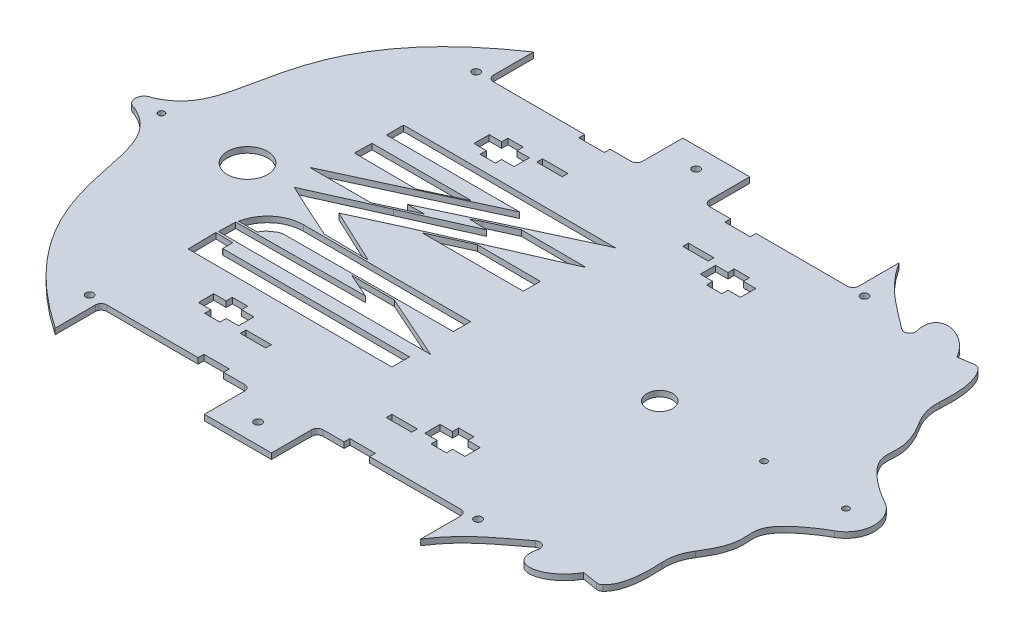
from build123d import *

# Parameters (mm, degrees)
BOSS_EXTRUDE1_OUTLINE_R   = 2
BOSS_EXTRUDE1_OUTLINE_W   = 13.3
BOSS_EXTRUDE1_OUTLINE_H   = 3
BOSS_EXTRUDE1_OUTLINE_R_2 = 1.65
BOSS_EXTRUDE1_OUTLINE_R_3 = 10.5
BOSS_EXTRUDE1_OUTLINE_R_4 = 6.79023159
BOSS_EXTRUDE1_DEPTH       = 3
CUT_EXTRUDE4_DEPTH        = 10


# Read off the part's stored shape, not the designer's step: Boss-Extrude1
with BuildPart() as part:
    # Boss-Extrude1 outline → Boss-Extrude1 (new body)
    with BuildSketch(Plane(origin=(0, 0, 0), x_dir=(1, 0, 0), z_dir=(0, 1, 0))):
        with BuildLine():
            Line((-17.5, -125), (17.5, -125))
            Line((17.5, -125), (17.5, -104))
            ThreePointArc((17.5, -104), (18.378679656, -101.878679656), (20.5, -101))
            Line((20.5, -101), (31.5, -101))
            Line((31.5, -101), (31.5, -98))
            Line((31.5, -98), (44.8, -98))
            Line((44.8, -98), (44.8, -101))
            Line((44.8, -101), (92.5, -101))
            ThreePointArc((92.5, -101), (94.621320344, -101.878679656), (95.5, -104))
            Line((95.5, -104), (95.5, -125))
            add(Edge.make_bspline(
                [(95.5, -125), (100.50637567, -117.140298034), (105.886665873, -111.407933588), (111.304893081, -106.912987865), (116.554589842, -103.049372367), (121.529527182, -99.421345381), (126.195868804, -95.78655124)],
                knots=[0, 0, 0, 0, 0, 0, 0, 1, 1, 1, 1, 1, 1, 1], degree=6))
            ThreePointArc((126.195868804, -95.78655124), (129.670016542, -95.635122312), (130.953228512, -98.867149581))
            add(Edge.make_bspline(
                [(153.274628862, -97.551277914), (145.048399434, -111.792305855), (127.194583112, -114.208852006), (130.953228512, -98.867149581)],
                knots=[0, 0, 0, 0, 1, 1, 1, 1], degree=3))
            Line((153.274628862, -97.551277914), (161.289057872, -98.799749198))
            ThreePointArc((161.289057872, -98.799749198), (162.627947201, -98.704411327), (163.791244557, -98.034744837))
            add(Edge.make_bspline(
                [(169.122281436, -72.559473626), (170.349939803, -91.949698752), (163.791244557, -98.034744837)],
                knots=[0, 0, 0, 1, 1, 1], degree=2))
            ThreePointArc((169.122281436, -72.559473626), (169.821390303, -65.299453256), (172.758472208, -58.623361671))
            add(Edge.make_bspline(
                [(172.758472208, -58.623361671), (188.119789729, -34.850874063), (172.499672596, -36.387007457), (178.196892258, -29.278969494), (184.712224404, -22.879053943), (192.076321024, -17.426235598), (200.000000002, -13.073844001)],
                knots=[0, 0, 0, 0, 0, 0, 0, 1, 1, 1, 1, 1, 1, 1], degree=6))
            ThreePointArc((200.000000002, -13.073844001), (207.735004137, 0), (200.000000002, 13.073844001))
            add(Edge.make_bspline(
                [(172.758472208, 58.623361671), (188.119789729, 34.850874063), (172.499672596, 36.387007457), (178.196892258, 29.278969494), (184.712224404, 22.879053943), (192.076321024, 17.426235598), (200.000000002, 13.073844001)],
                knots=[0, 0, 0, 0, 0, 0, 0, 1, 1, 1, 1, 1, 1, 1], degree=6))
            ThreePointArc((172.758472208, 58.623361671), (169.821390303, 65.299453256), (169.122281436, 72.559473626))
            add(Edge.make_bspline(
                [(169.122281436, 72.559473626), (170.349939803, 91.949698752), (163.791244557, 98.034744837)],
                knots=[0, 0, 0, 1, 1, 1], degree=2))
            ThreePointArc((163.791244557, 98.034744837), (162.627947201, 98.704411327), (161.289057872, 98.799749198))
            Line((161.289057872, 98.799749198), (153.274628862, 97.551277914))
            add(Edge.make_bspline(
                [(153.274628862, 97.551277914), (145.048399434, 111.792305855), (127.194583112, 114.208852006), (130.953228512, 98.867149581)],
                knots=[0, 0, 0, 0, 1, 1, 1, 1], degree=3))
            ThreePointArc((130.953228512, 98.867149581), (129.670016542, 95.635122312), (126.195868804, 95.78655124))
            add(Edge.make_bspline(
                [(95.5, 125), (100.50637567, 117.140298034), (105.886665873, 111.407933588), (111.304893081, 106.912987865), (116.554589842, 103.049372367), (121.529527182, 99.421345381), (126.195868804, 95.78655124)],
                knots=[0, 0, 0, 0, 0, 0, 0, 1, 1, 1, 1, 1, 1, 1], degree=6))
            Line((95.5, 125), (95.5, 104))
            ThreePointArc((95.5, 104), (94.621320344, 101.878679656), (92.5, 101))
            Line((92.5, 101), (44.8, 101))
            Line((44.8, 101), (44.8, 98))
            Line((44.8, 98), (31.5, 98))
            Line((31.5, 98), (31.5, 101))
            Line((31.5, 101), (20.5, 101))
            ThreePointArc((20.5, 101), (18.378679656, 101.878679656), (17.5, 104))
            Line((17.5, 104), (17.5, 125))
            Line((17.5, 125), (-17.5, 125))
            Line((-17.5, 125), (-17.5, 104))
            ThreePointArc((-17.5, 104), (-18.378679656, 101.878679656), (-20.5, 101))
            Line((-20.5, 101), (-31.5, 101))
            Line((-31.5, 101), (-31.5, 98))
            Line((-31.5, 98), (-44.8, 98))
            Line((-44.8, 98), (-44.8, 101))
            Line((-44.8, 101), (-92.5, 101))
            ThreePointArc((-92.5, 101), (-94.621320344, 101.878679656), (-95.5, 104))
            Line((-95.5, 104), (-95.5, 125))
            add(Edge.make_bspline(
                [(-95.5, 125), (-175.934318521, 70.42019649), (-139.024894587, 19.752046012), (-174.613334244, 4.587313777)],
                knots=[0, 0, 0, 0, 1, 1, 1, 1], degree=3))
            ThreePointArc((-174.613334244, 4.587313777), (-178.628134245, 0), (-174.613334244, -4.587313777))
            add(Edge.make_bspline(
                [(-95.5, -125), (-175.934318521, -70.42019649), (-139.024894587, -19.752046012), (-174.613334244, -4.587313777)],
                knots=[0, 0, 0, 0, 1, 1, 1, 1], degree=3))
            Line((-95.5, -125), (-95.5, -104))
            ThreePointArc((-95.5, -104), (-94.621320344, -101.878679656), (-92.5, -101))
            Line((-92.5, -101), (-44.8, -101))
            Line((-44.8, -101), (-44.8, -98))
            Line((-44.8, -98), (-31.5, -98))
            Line((-31.5, -98), (-31.5, -101))
            Line((-31.5, -101), (-20.5, -101))
            ThreePointArc((-20.5, -101), (-18.378679656, -101.878679656), (-17.5, -104))
            Line((-17.5, -104), (-17.5, -125))
        make_face()
        with Locations((-101.5, -101)):
            Circle(BOSS_EXTRUDE1_OUTLINE_R, mode=Mode.SUBTRACT)
        with Locations((0, -114.5)):
            Circle(BOSS_EXTRUDE1_OUTLINE_R, mode=Mode.SUBTRACT)
        Polygon((-63.15, -79.25), (-63.15, -76), (-69.65, -76), (-69.65, -68), (-63.15, -68), (-63.15, -64.75), (-55.15, -64.75), (-55.15, -68), (-48.65, -68), (-48.65, -76), (-55.15, -76), (-55.15, -79.25), align=None, mode=Mode.SUBTRACT)
        with Locations((-38.15, -77.5)):
            Rectangle(BOSS_EXTRUDE1_OUTLINE_W, BOSS_EXTRUDE1_OUTLINE_H, mode=Mode.SUBTRACT)
        with Locations((101.5, -101)):
            Circle(BOSS_EXTRUDE1_OUTLINE_R, mode=Mode.SUBTRACT)
        with Locations((38.15, -77.5)):
            Rectangle(BOSS_EXTRUDE1_OUTLINE_W, BOSS_EXTRUDE1_OUTLINE_H, mode=Mode.SUBTRACT)
        Polygon((55.15, -68), (55.15, -64.75), (63.15, -64.75), (63.15, -68), (69.65, -68), (69.65, -76), (63.15, -76), (63.15, -79.25), (55.15, -79.25), (55.15, -76), (48.65, -76), (48.65, -68), align=None, mode=Mode.SUBTRACT)
        with Locations((-165, 0)):
            Circle(BOSS_EXTRUDE1_OUTLINE_R_2, mode=Mode.SUBTRACT)
        with Locations((-120, 0)):
            Circle(BOSS_EXTRUDE1_OUTLINE_R_3, mode=Mode.SUBTRACT)
        with Locations((-101.5, 101)):
            Circle(BOSS_EXTRUDE1_OUTLINE_R, mode=Mode.SUBTRACT)
        Polygon((-63.15, 79.25), (-55.15, 79.25), (-55.15, 76), (-48.65, 76), (-48.65, 68), (-55.15, 68), (-55.15, 64.75), (-63.15, 64.75), (-63.15, 68), (-69.65, 68), (-69.65, 76), (-63.15, 76), align=None, mode=Mode.SUBTRACT)
        with Locations((-38.15, 77.5)):
            Rectangle(BOSS_EXTRUDE1_OUTLINE_W, BOSS_EXTRUDE1_OUTLINE_H, mode=Mode.SUBTRACT)
        with Locations((0, 114.5)):
            Circle(BOSS_EXTRUDE1_OUTLINE_R, mode=Mode.SUBTRACT)
        with Locations((95.5, 0)):
            Circle(BOSS_EXTRUDE1_OUTLINE_R_4, mode=Mode.SUBTRACT)
        with Locations((150, 0)):
            Circle(BOSS_EXTRUDE1_OUTLINE_R_2, mode=Mode.SUBTRACT)
        with Locations((192.818678179, 0)):
            Circle(BOSS_EXTRUDE1_OUTLINE_R_2, mode=Mode.SUBTRACT)
        with Locations((38.15, 77.5)):
            Rectangle(BOSS_EXTRUDE1_OUTLINE_W, BOSS_EXTRUDE1_OUTLINE_H, mode=Mode.SUBTRACT)
        Polygon((63.15, 79.25), (63.15, 76), (69.65, 76), (69.65, 68), (63.15, 68), (63.15, 64.75), (55.15, 64.75), (55.15, 68), (48.65, 68), (48.65, 76), (55.15, 76), (55.15, 79.25), align=None, mode=Mode.SUBTRACT)
        with Locations((101.5, 101)):
            Circle(BOSS_EXTRUDE1_OUTLINE_R, mode=Mode.SUBTRACT)
    extrude(amount=BOSS_EXTRUDE1_DEPTH)

    # Sketch5 → Cut-Extrude4 (cut)
    with BuildSketch(Plane(origin=(0, 3, 0), x_dir=(1, 0, 0), z_dir=(0, 1, 0))):
        Polygon((-16.280980711, 43.449751583), (14.519017205, 57.749751587), (-96.360980711, 57.969751583), (-96.360980711, 49.788115102), (-96.368321319, 48.973981164), (-26.707422059, 48.973981164), (-101.834351235, 14.242892369), (-69.727593728, 14.242892369), (-50.673024428, 23.089657287), (-59.428531363, 23.089657287), align=None)
        with BuildLine():
            Line((10.119019289, -22.550248417), (10.119019289, -13.530248417))
            Line((10.119019289, -13.530248417), (-77.459409297, -13.309647841))
            ThreePointArc((-77.459409297, -13.309647841), (-89.491285343, -17.652122629), (-95.920980711, -28.710248417))
            Line((-95.920980711, -28.710248417), (-86.240980711, -28.710248417))
            Line((-86.240980711, -28.710248417), (-84.480980711, -26.070248417))
            Line((-84.480980711, -26.070248417), (-81.400980711, -23.870248417))
            ThreePointArc((-81.400980711, -23.870248417), (-79.728995968, -23.038599596), (-77.880980711, -22.770248417))
            Line((-77.880980711, -22.770248417), (10.119019289, -22.550248417))
        make_face()
        Polygon((-87.780980711, -39.930248417), (-96.800980711, -39.710248417), (-96.580980711, -54.450248417), (7.479019289, -54.670248417), (10.119019289, -54.670248417), (10.119019289, -45.430248417), (-87.340980711, -45.210248417), (-87.780980711, -45.210248417), align=None)
        with BuildLine():
            Line((-32.340980711, 34.869751583), (-36.520980711, 32.669751583))
            Line((-36.520980711, 32.669751583), (-27.280980711, 32.229751583))
            Line((-27.280980711, 32.229751583), (-60.889045756, 17.269751583))
            Line((-60.889045756, 17.269751583), (-96.800980711, 1.209751583))
            add(Edge.make_bspline(
                [(-44.880980711, -12.210248417), (-45.028215524, -12.284985846), (-45.15756879, -12.435061949), (-45.322685148, -12.434460703), (-52.782217529, -12.407297982), (-60.241720518, -12.299093668), (-67.699320643, -12.127158997), (-68.029467819, -12.119547467), (-68.28581423, -11.822434017), (-68.588105626, -11.689486642), (-78.217869194, -7.454328759), (-87.389608862, -3.237654479), (-96.800980711, 1.209751583)],
                knots=[0, 0, 0, 0, 1, 1, 1, 2, 2, 2, 3, 3, 3, 4, 4, 4, 4], degree=3))
            Line((-44.880980711, -12.210248417), (-73.480980711, 1.209751583))
            Line((-73.480980711, 1.209751583), (-51.480980711, 11.329751583))
            Line((-51.480980711, 11.329751583), (-47.080980711, 13.309751583))
            Line((-47.080980711, 13.309751583), (-15.400980711, 27.389751583))
            Line((-15.400980711, 27.389751583), (5.719019289, 36.629751583))
            Line((5.719019289, 36.629751583), (15.727789982, 41.196509707))
            Line((15.727789982, 41.196509707), (-18.200538791, 41.340801276))
            Line((-18.200538791, 41.340801276), (-32.340980711, 34.869751583))
        make_face()
        Polygon((-42.815609922, 14.028912799), (10.119019289, 14.028912799), (10.119019289, 22.960020577), (-22.980191093, 23.089657287), align=None)
        Polygon((-44.286259363, 41.469751583), (-96.360980711, 41.469751583), (-96.580980711, 32.449751583), (-64.220138747, 32.229751583), align=None)
        Polygon((-41.838326055, -23.622973688), (-29.040980711, -29.370248417), (-96.360980711, -29.810248417), (-96.580980711, -38.610248417), (12.979019289, -38.830248417), (14.648807642, -38.830248417), (-19.635167197, -23.622973688), align=None)
    extrude(amount=-CUT_EXTRUDE4_DEPTH, mode=Mode.SUBTRACT)


solid = part.part
